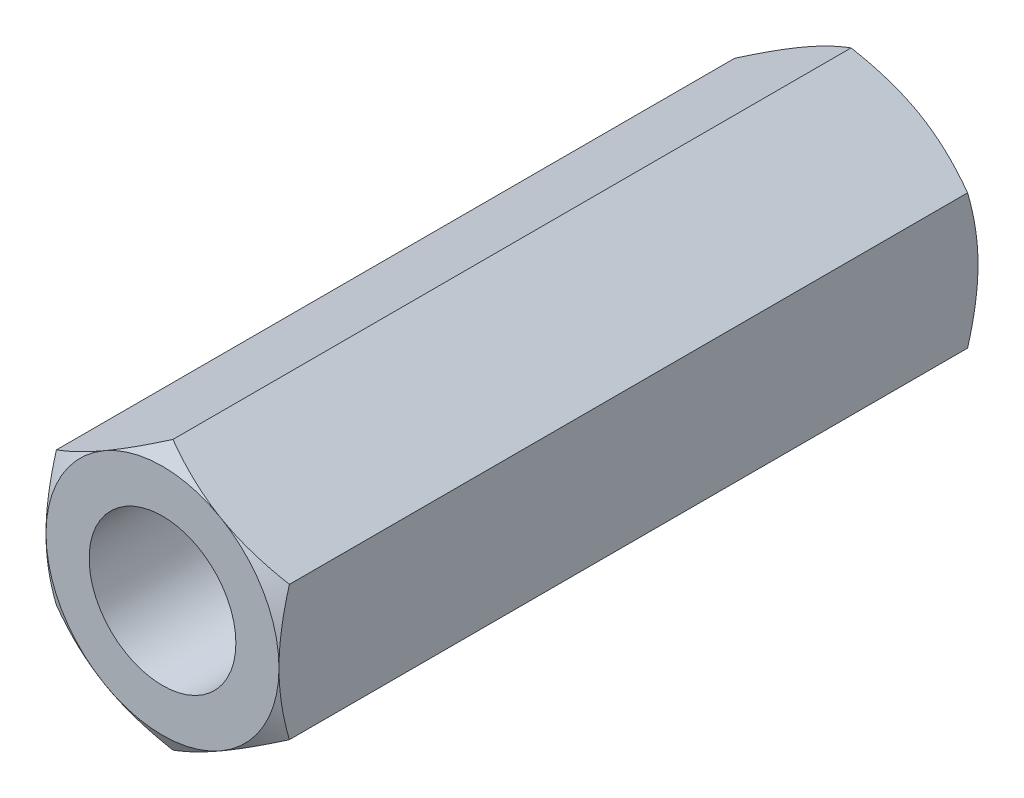
from build123d import *

# Parameters (mm, degrees)
EXTRUDE1_DEPTH          = 19.05
EXTRUDE1_DEPTH_BACK     = 19.05
SKETCH1_R               = 2.413
SWEEP1_PITCH            = 0.79375
EXTRUDE2_DEPTH          = 41.085198093
SKETCH8_OUTSIDE_W       = 165.716
SKETCH8_OUTSIDE_H       = 167.68
SKETCH8_OUTSIDE_R       = 6.35
EXTRUDE4_DEPTH          = 41.085198093
EXTRUDE4_DRAFT          = -60
MIRROR1_COPY_1_SKETCH_W = 165.716
MIRROR1_COPY_1_SKETCH_H = 167.68
MIRROR1_COPY_1_SKETCH_R = 6.35
MIRROR1_COPY_1_DEPTH    = 41.085198093
MIRROR1_COPY_1_DRAFT    = -60
SKETCH9_W               = 12.7
SKETCH9_H               = 2.4638
SKETCH13_R              = 4
CUT_EXTRUDE1_DEPTH      = 25.4


with BuildPart() as part:
    # Sketch1 → Extrude1 (new, two sides: drawn at the far end of the back side and taken through both)
    with BuildSketch(Plane.XY.offset(-EXTRUDE1_DEPTH_BACK)):
        Polygon((0, 7.332348419), (-6.35, 3.666174209), (-6.35, -3.666174209), (0, -7.332348419), (6.35, -3.666174209), (6.35, 3.666174209), align=None)
        with Locations(Location((0, 0, 0), (0, 0, 180))):
            Circle(SKETCH1_R, mode=Mode.SUBTRACT)
    extrude(amount=EXTRUDE1_DEPTH + EXTRUDE1_DEPTH_BACK)

    # Sweep1: arcs per turn and ends read off the stored shape
    # Sweep1: the profile of Sketch12 profile screwed along a right-hand helix through 49 turns, 8 arcs to a turn; built about Z, then put on its axis
    sweep1_z = Axis((0, 0, 0), (0, 0, 1))
    sweep1_corners = [(2.4133, 0, -0.694704455), (2.4133, 0, 0.000173205), (1.897444252, 0, -0.29765625), (1.897444252, 0, -0.396875)]
    with BuildLine(mode=Mode.PRIVATE) as sweep1_profile:
        Line(sweep1_corners[0], sweep1_corners[1])
        Line(sweep1_corners[1], sweep1_corners[2])
        Line(sweep1_corners[2], sweep1_corners[3])
        Line(sweep1_corners[3], sweep1_corners[0])
    sweep1_cap = Face(sweep1_profile.wire())
    sweep1_turn_angles = [0, 22.5, 45, 67.5, 90, 112.5, 135, 157.5, 180, 202.5, 225, 247.5, 270, 292.5, 315, 337.5, 360]
    sweep1_turn_weights = [1, 0.9238795325112867, 1, 0.9238795325112867, 1, 0.9238795325112867, 1, 0.9238795325112867, 1, 0.9238795325112867, 1, 0.9238795325112867, 1, 0.9238795325112867, 1, 0.9238795325112867, 1]
    sweep1_turn_rails = [Edge.make_bspline([Vector(p[0], p[1], 0).rotate(sweep1_z, sweep1_turn_angles[k]) / sweep1_turn_weights[k] + Vector(0, 0, p[2] + SWEEP1_PITCH * sweep1_turn_angles[k] / 360) for k in range(17)], [0, 0, 0, 1, 1, 2, 2, 3, 3, 4, 4, 5, 5, 6, 6, 7, 7, 8, 8, 8], 2, sweep1_turn_weights) for p in sweep1_corners]
    sweep1_turn_sides = [Face.make_surface_from_curves(sweep1_turn_rails[p[0]], sweep1_turn_rails[p[1]]) for p in [(0, 1), (1, 2), (2, 3), (3, 0)]]
    sweep1 = Plane(origin=(0, 0, -19.05), x_dir=(0, 1, 0), z_dir=(0, 0, 1)) * Solid(Shell([*[p.moved(Location((0, 0, SWEEP1_PITCH * i))) for i in range(49) for p in sweep1_turn_sides], sweep1_cap, sweep1_cap.rotate(sweep1_z, 17640).moved(Location((0, 0, SWEEP1_PITCH * 17640 / 360)))]))
    add(sweep1)

    # Sketch6 → Extrude2 (cut, through all)
    with BuildSketch(Plane(origin=(0, 0, -19.05), x_dir=(-1, 0, 0), z_dir=(0, 0, -1))):
        Polygon((0, 7.332348419), (-6.35, 3.666174209), (-6.35, -3.666174209), (0, -7.332348419), (6.35, -3.666174209), (6.35, 3.666174209), align=None)
    extrude2 = extrude(amount=EXTRUDE2_DEPTH, mode=Mode.SUBTRACT)

    # Extrude3 cone 1 section (through the dimple's axis) → Extrude3 (revolve, cut)
    with BuildSketch(Plane(origin=(0, 0, -19.05), x_dir=(0, 1, 0), z_dir=(1, 0, 0))):
        Polygon((0, 0), (2.4638, 0), (0, 2.642102028), align=None)
    extrude3 = revolve(axis=Axis((0, 0, -19.05), (0, 0, 1)), mode=Mode.SUBTRACT)


with BuildPart() as extrude4_tool:
    # Sketch8 outside → Extrude4 (with draft: the straight prism first)
    with BuildSketch(Plane(origin=(0, 0, -19.05), x_dir=(-1, 0, 0), z_dir=(0, 0, -1))):
        Rectangle(SKETCH8_OUTSIDE_W, SKETCH8_OUTSIDE_H)
        Circle(SKETCH8_OUTSIDE_R, mode=Mode.SUBTRACT)
    extrude(amount=-EXTRUDE4_DEPTH)
    # Extrude4: the draft: its side faces are tilted about the plane it starts from
    extrude4_sides = [extrude4_tool.faces().sort_by_distance(p)[0] for p in [
        (0, -83.84, 1.492599046),
        (-82.858, 0, 1.492599046),
        (0, 83.84, 1.492599046),
        (82.858, 0, 1.492599046),
        (6.35, 0, 1.492599046),
    ]]
    draft(extrude4_sides, Plane(origin=(0, 0, -19.05), x_dir=(-1, 0, 0), z_dir=(0, 0, -1)), EXTRUDE4_DRAFT)


with BuildPart() as part_1:
    add(part.part)

    # Extrude4: cut by extrude4_tool
    add(extrude4_tool.part, mode=Mode.SUBTRACT)

    # Mirror1: Extrude2, Extrude3 across plane
    add(extrude2.mirror(Plane.XY), mode=Mode.SUBTRACT)
    add(extrude3.mirror(Plane.XY), mode=Mode.SUBTRACT)


with BuildPart() as mirror1_copy_1_tool:
    # Mirror1 copy 1 sketch → Mirror1 copy 1 (with draft: the straight prism first)
    with BuildSketch(Plane(origin=(0, 0, 19.05), x_dir=(-1, 0, 0), z_dir=(0, 0, 1))):
        Rectangle(MIRROR1_COPY_1_SKETCH_W, MIRROR1_COPY_1_SKETCH_H)
        Circle(MIRROR1_COPY_1_SKETCH_R, mode=Mode.SUBTRACT)
    extrude(amount=-MIRROR1_COPY_1_DEPTH)
    # Mirror1 copy 1: the draft: its side faces are tilted about the plane it starts from
    mirror1_copy_1_sides = [mirror1_copy_1_tool.faces().sort_by_distance(p)[0] for p in [
        (0, -83.84, -1.492599046),
        (-82.858, 0, -1.492599046),
        (0, 83.84, -1.492599046),
        (82.858, 0, -1.492599046),
        (6.35, 0, -1.492599046),
    ]]
    draft(mirror1_copy_1_sides, Plane(origin=(0, 0, 19.05), x_dir=(-1, 0, 0), z_dir=(0, 0, 1)), MIRROR1_COPY_1_DRAFT)


with BuildPart() as part_2:
    add(part_1.part)

    # Mirror1 copy 1: cut by mirror1_copy_1_tool
    add(mirror1_copy_1_tool.part, mode=Mode.SUBTRACT)

    # Sketch9 → Revolve 2 (revolve)
    with BuildSketch(Plane(origin=(0, 0, 0), x_dir=(0, 0, -1), z_dir=(1, 0, 0)), mode=Mode.PRIVATE) as revolve_2_sk:
        with Locations((0, 1.2319)):
            Rectangle(SKETCH9_W, SKETCH9_H)
    revolve(revolve_2_sk.sketch.rotate(Axis((0, 0, 19.05), (0, 0, -1)), 270), axis=Axis((0, 0, 19.05), (0, 0, -1)))

    # Sketch13 → Cut-Extrude1 (cut)
    with BuildSketch(Plane.XY.offset(19.05)):
        Circle(SKETCH13_R)
    extrude(amount=-CUT_EXTRUDE1_DEPTH, mode=Mode.SUBTRACT)


solid = part_2.part
